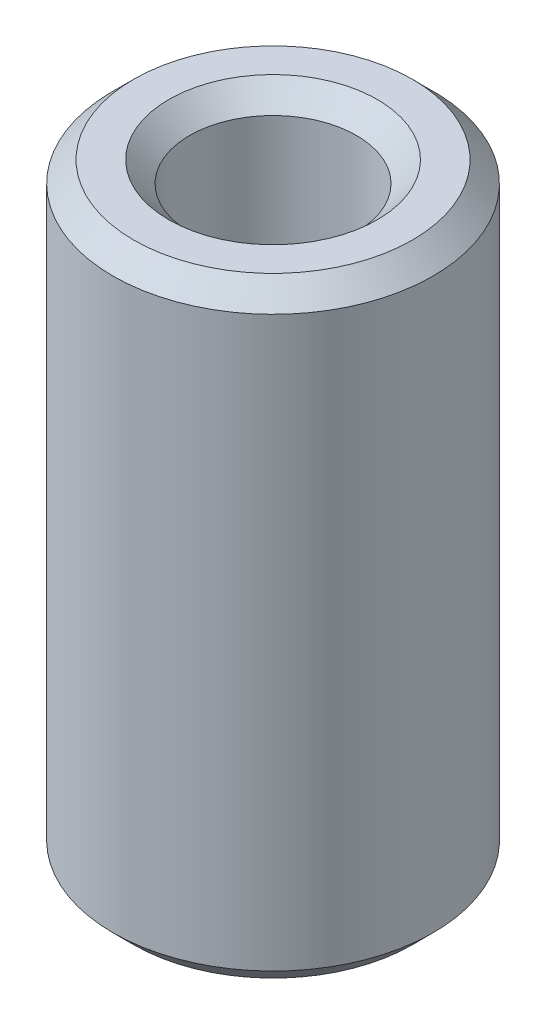
from build123d import *

# Parameters (mm, degrees)
SKETCH1_R           = 20
BOSS_EXTRUDE1_DEPTH = 76.245108286
SKETCH2_R           = 10.428029362
CUT_EXTRUDE1_DEPTH  = 82.32230037
CHAMFER1_SIZE       = 2.594813467


with BuildPart() as part:
    # Sketch1 → Boss-Extrude1 (new body)
    with BuildSketch(Plane(origin=(0, 0, 0), x_dir=(1, 0, 0), z_dir=(0, 1, 0))):
        Circle(SKETCH1_R)
    extrude(amount=BOSS_EXTRUDE1_DEPTH)

    # Sketch2 → Cut-Extrude1 (cut, through all)
    with BuildSketch(Plane(origin=(0, 0, 0), x_dir=(1, 0, 0), z_dir=(0, 1, 0))):
        Circle(SKETCH2_R)
    extrude(amount=CUT_EXTRUDE1_DEPTH, mode=Mode.SUBTRACT)

    # Chamfer1
    chamfer1_edges = [part.edges().sort_by_distance(p)[0] for p in [
        (-10.428029362, 76.245108286, 0),
        (-10.428029362, 0, 0),
        (-20, 0, 0),
        (-20, 76.245108286, 0),
    ]]
    chamfer(chamfer1_edges, length=CHAMFER1_SIZE)


solid = part.part
